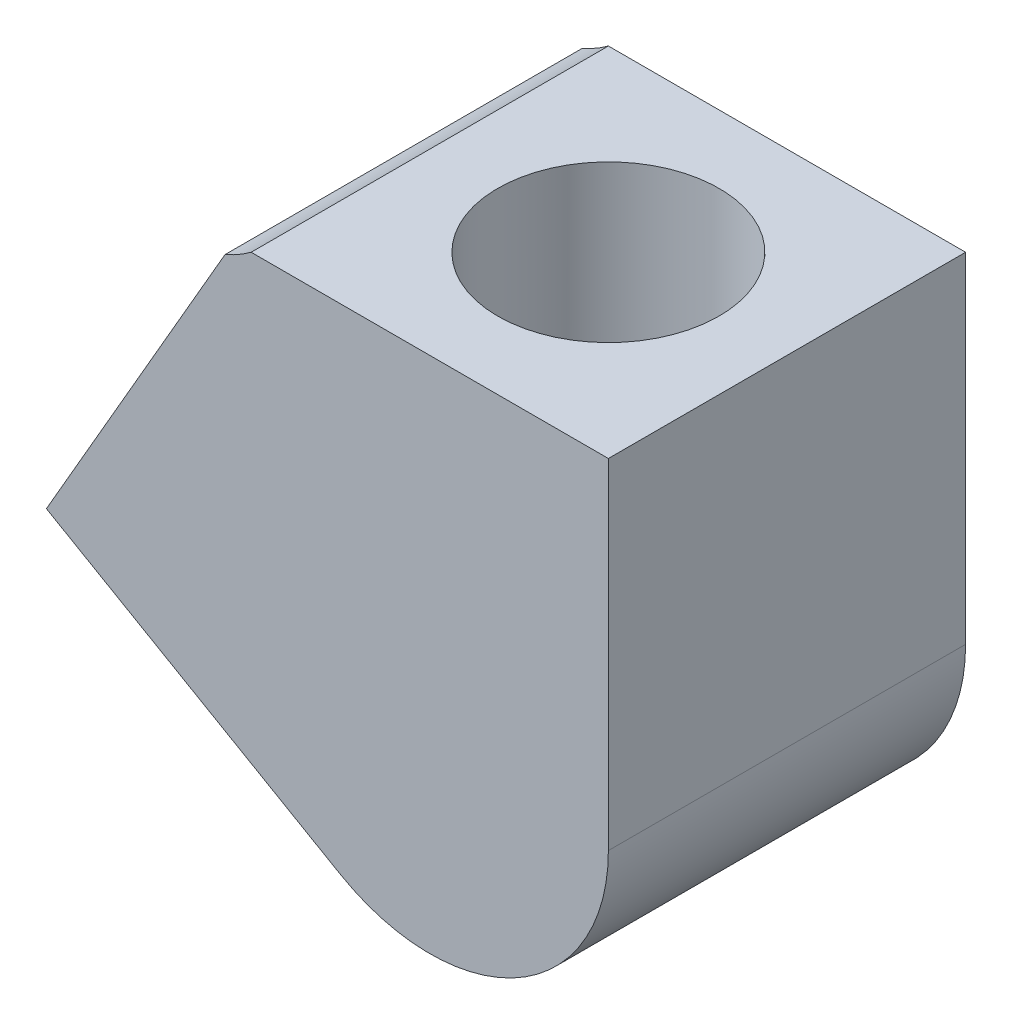
from build123d import *

# Parameters (mm, degrees)
SKETCH2_R                = 13.15
SKETCH2_R_2              = 8.15
BOSS_EXTRUDE1_DEPTH      = 25
BOSS_EXTRUDE2_DEPTH      = 13.15
BOSS_EXTRUDE2_DEPTH_BACK = 13.15
SKETCH4_R                = 8.15
CUT_EXTRUDE1_DEPTH       = 25
CUT_EXTRUDE2_START       = -25
SKETCH5_R                = 8.15
CUT_EXTRUDE2_DEPTH       = 25
FILLET1_R                = 10


with BuildPart() as part:
    # Sketch2 → Boss-Extrude1 (new body)
    # profile 1 of 5: a face of its own
    with BuildSketch(Plane(origin=(0, 0, 0), x_dir=(1, 0, 0), z_dir=(0, 1, 0))):
        with BuildLine():
            Line((-13.15, 13.15), (-13.15, 0))
            ThreePointArc((-13.15, 0), (-9.298454179, 9.298454166), (-1.9e-08, 13.15))
            Line((-1.9e-08, 13.15), (-13.15, 13.15))
        make_face()
    # profile 2 of 5: a face of its own
    with BuildSketch(Plane(origin=(0, 0, 0), x_dir=(1, 0, 0), z_dir=(0, 1, 0))):
        Circle(SKETCH2_R)
        with Locations(Location((0, 0, 0), (0, 0, 270))):
            Circle(SKETCH2_R_2, mode=Mode.SUBTRACT)
    # profile 3 of 5: a face of its own
    with BuildSketch(Plane(origin=(0, 0, 0), x_dir=(1, 0, 0), z_dir=(0, 1, 0))):
        with BuildLine():
            ThreePointArc((-1.9e-08, 13.15), (9.298454166, 9.298454179), (13.15, 0))
            Line((13.15, 0), (13.15, 13.15))
            Line((13.15, 13.15), (-1.9e-08, 13.15))
        make_face()
    # profile 4 of 5: a face of its own
    with BuildSketch(Plane(origin=(0, 0, 0), x_dir=(1, 0, 0), z_dir=(0, 1, 0))):
        with BuildLine():
            ThreePointArc((13.15, 0), (9.298454189, -9.298454156), (4.6e-08, -13.15))
            Line((4.6e-08, -13.15), (13.15, -13.15))
            Line((13.15, -13.15), (13.15, 0))
        make_face()
    # profile 5 of 5: a face of its own
    with BuildSketch(Plane(origin=(0, 0, 0), x_dir=(1, 0, 0), z_dir=(0, 1, 0))):
        with BuildLine():
            Line((-13.15, 0), (-13.15, -13.15))
            Line((-13.15, -13.15), (4.6e-08, -13.15))
            ThreePointArc((4.6e-08, -13.15), (-9.298454156, -9.298454189), (-13.15, 0))
        make_face()
    extrude(amount=BOSS_EXTRUDE1_DEPTH)

    # Sketch3 → Boss-Extrude2 (add, two sides: drawn at the far end of the back side and taken through both)
    with BuildSketch(Plane.XY.offset(-BOSS_EXTRUDE2_DEPTH_BACK)):
        with BuildLine():
            Line((-28.225635095, 1.11176594), (-6.575, -11.38823406))
            ThreePointArc((-6.575, -11.38823406), (11.38823406, -6.575), (6.575, 11.38823406))
            Line((6.575, 11.38823406), (-15.075635095, 23.88823406))
            Line((-15.075635095, 23.88823406), (-28.225635095, 1.11176594))
        make_face()
    extrude(amount=BOSS_EXTRUDE2_DEPTH + BOSS_EXTRUDE2_DEPTH_BACK)

    # Sketch4 → Cut-Extrude1 (cut)
    with BuildSketch(Plane(origin=(-21.650635095, 12.5, 0), x_dir=(0, 0, 1), z_dir=(-0.8660254037844418, 0.49999999999999445, 0))):
        with Locations(Location((0, 0, 0), (0, 0, 270))):
            Circle(SKETCH4_R)
    extrude(amount=-CUT_EXTRUDE1_DEPTH, mode=Mode.SUBTRACT)

    # Sketch5 → Cut-Extrude2 (cut)
    with BuildSketch(Plane(origin=(0, 25, 0), x_dir=(1, 0, 0), z_dir=(0, 1, 0)).offset(CUT_EXTRUDE2_START)):
        with Locations(Location((0, 0, 0), (0, 0, 270))):
            Circle(SKETCH5_R)
    extrude(amount=CUT_EXTRUDE2_DEPTH, mode=Mode.SUBTRACT)

    # Fillet1
    # the kernel refuses this fillet: 10 mm, written as the material it adds along each edge
    with BuildSketch(Plane(origin=(-13.15, 22.77646812, 13.15), x_dir=(0, 1, 0), z_dir=(0, 0, -1))) as fillet1_piece_1:
        with BuildLine():
            CenterArc((10.274215146, -5.93182088), FILLET1_R, 143.616854507, 12.766290987)
            Line((1.11176594, -1.925635095), (0, 0))
            Line((0, 0), (2.22353188, 0))
        make_face()
    extrude(amount=26.3)


solid = part.part
